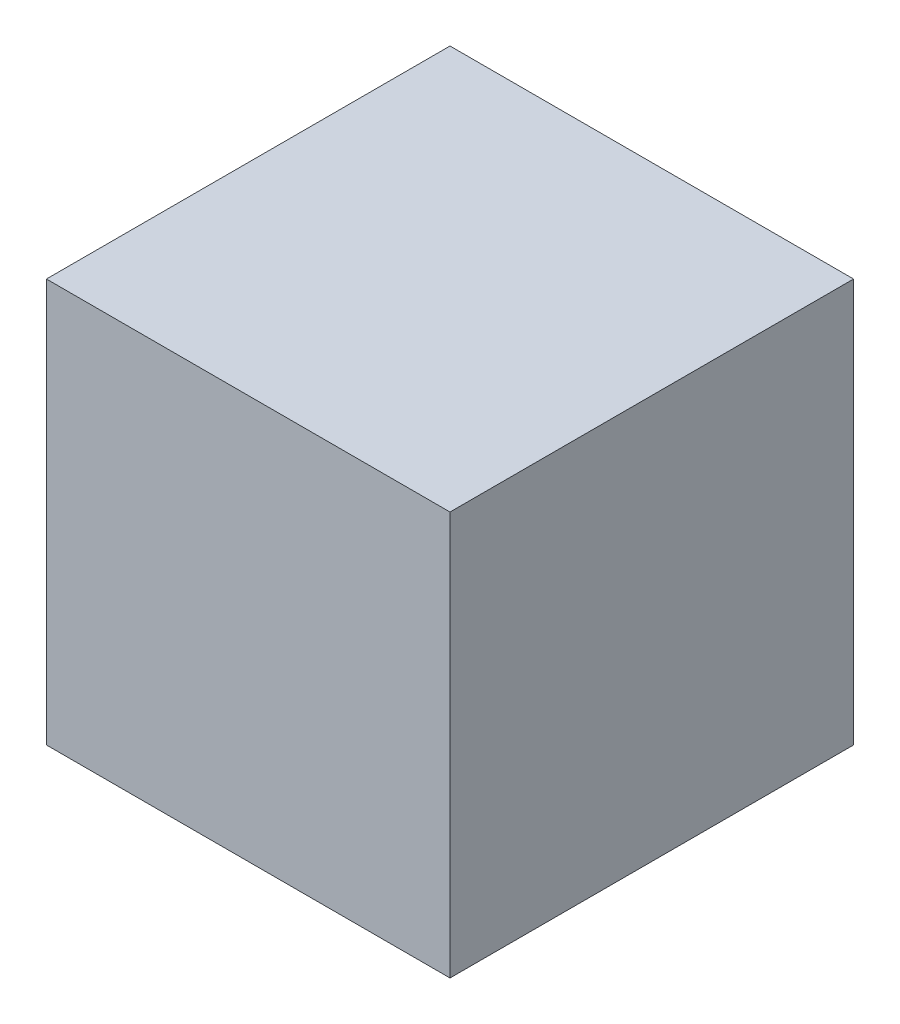
from build123d import *

# Parameters (mm, degrees)
SKETCH1_W           = 2133.6
SKETCH1_H           = 2133.6
BOSS_EXTRUDE1_DEPTH = 1066.8
SHELL1_T            = 304.8


with BuildPart() as part:
    # Sketch1 → Boss-Extrude1 (new, symmetric)
    with BuildSketch(Plane.XY):
        Rectangle(SKETCH1_W, SKETCH1_H)
    extrude(amount=BOSS_EXTRUDE1_DEPTH, both=True)

    # Shell1 (no face opened: a closed hollow body)
    add(offset(amount=-SHELL1_T, mode=Mode.PRIVATE), mode=Mode.SUBTRACT)


solid = part.part
